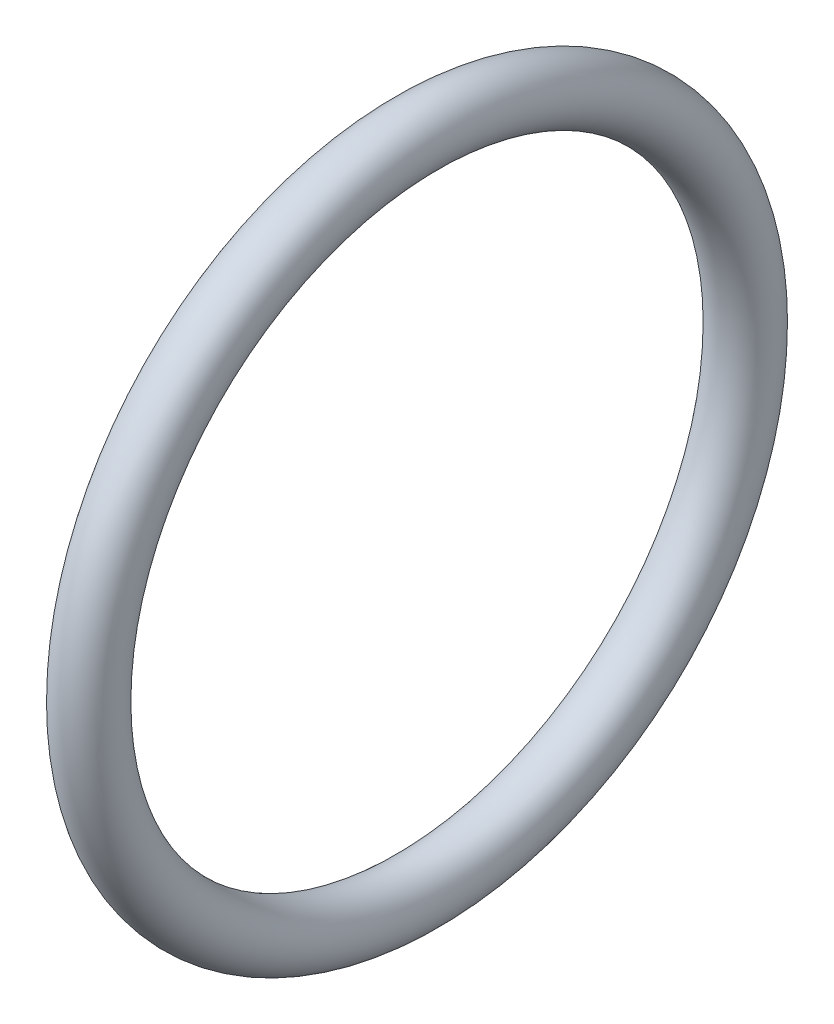
from build123d import *

# Parameters (mm, degrees)
SKETCH1_R = 6.35


with BuildPart() as part:
    # Sketch1 → Revolve1 (revolve)
    with BuildSketch(Plane.XY):
        with Locations((0, 69.85)):
            Circle(SKETCH1_R)
    revolve(axis=Axis((0, 0, 0), (1, 0, 0)))


solid = part.part
